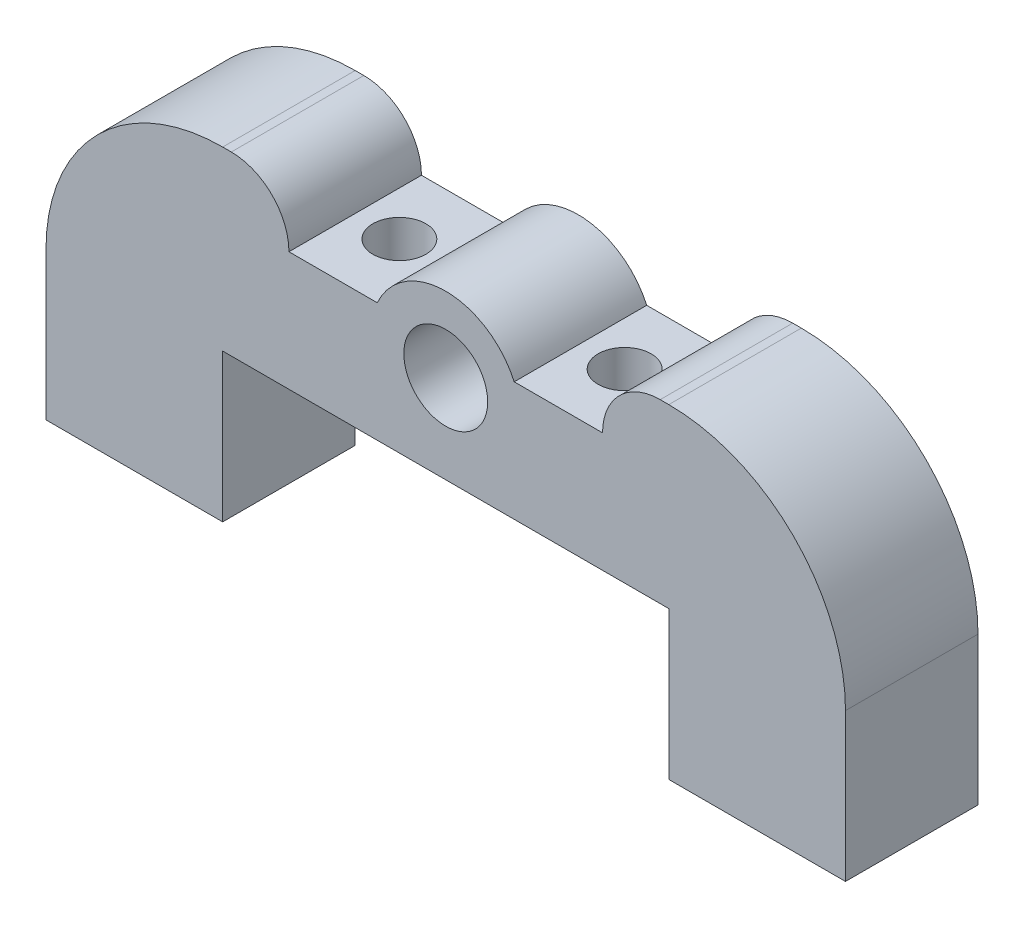
from build123d import *

# Parameters (mm, degrees)
BOSS_EXTRUDE1_DEPTH   = 6
F_6_CLEARANCE_HOLE1_D = 3.7973
CUT_EXTRUDE1_REACH    = 34.362
FILLET1_R             = 2.61
M2_CLEARANCE_HOLE1_D  = 2.4


with BuildPart() as part:
    # Sketch1 → Boss-Extrude1 (new body)
    with BuildSketch(Plane.XY):
        with BuildLine():
            ThreePointArc((-8, 6.7), (-5.656854249, 12.356854249), (0, 14.7))
            Line((0, 14.7), (20.2, 14.7))
            ThreePointArc((20.2, 14.7), (25.856854249, 12.356854249), (28.2, 6.7))
            Line((28.2, 6.7), (28.2, 0))
            Line((28.2, 0), (20.2, 0))
            Line((20.2, 0), (20.2, 6.7))
            Line((20.2, 6.7), (0, 6.7))
            Line((0, 6.7), (0, 0))
            Line((0, 0), (-8, 0))
            Line((-8, 0), (-8, 6.7))
        make_face()
    extrude(amount=BOSS_EXTRUDE1_DEPTH)

    # #6 Clearance Hole1 (through all)
    with Locations(Plane.XY.offset(6)):
        with Locations((10.1, 10.7)):
            Hole(F_6_CLEARANCE_HOLE1_D / 2)

    # Sketch5 → Cut-Extrude1 (cut, up to next)
    with BuildSketch(Plane.XY.offset(6), mode=Mode.PRIVATE) as cut_extrude1_sk1:
        with BuildLine():
            Line((7, 14.7), (3, 14.7))
            Line((3, 14.7), (3, 12.093133814))
            Line((3, 12.093133814), (7, 12.093133814))
            ThreePointArc((7, 12.093133814), (10.1, 14.09865), (13.2, 12.093133814))
            Line((13.2, 12.093133814), (17.2, 12.093133814))
            Line((17.2, 12.093133814), (17.2, 14.7))
            Line((17.2, 14.7), (13.2, 14.7))
            Line((13.2, 14.7), (7, 14.7))
        make_face()
    cut_extrude1_tool1 = extrude(cut_extrude1_sk1.sketch, amount=-CUT_EXTRUDE1_REACH, mode=Mode.PRIVATE) & part.part
    add(cut_extrude1_tool1.solids().sort_by_distance((10.1, 14.243023, 6))[0], mode=Mode.SUBTRACT)

    # Fillet1
    # the kernel refuses this fillet: 2.61 mm, written as the material it takes off along each edge
    with BuildSketch(Plane(origin=(17.2, 14.7, 12.524995297), x_dir=(1, 0, 0), z_dir=(0, 0, -1))) as fillet1_piece_1:
        with BuildLine():
            CenterArc((2.609998119, 2.61), FILLET1_R, 180.068794764, 89.931205236)
            Line((0, 2.606866186), (-0.052199962, 2.60680351))
            Line((-0.052199962, 2.60680351), (-0.0522, 0))
            Line((-0.0522, 0), (0, -0.0522))
            Line((0, -0.0522), (2.609998119, -0.0522))
            Line((2.609998119, -0.0522), (2.609998119, 0))
        make_face()
    extrude(amount=19.049990593, mode=Mode.SUBTRACT)
    with BuildSketch(Plane(origin=(3, 14.7, 12.524995297), x_dir=(-1, 0, 0), z_dir=(0, 0, -1))) as fillet1_piece_2:
        with BuildLine():
            CenterArc((2.609998119, -2.61), FILLET1_R, 90, 89.931205236)
            Line((0, -2.606866186), (-0.052199962, -2.60680351))
            Line((-0.052199962, -2.60680351), (-0.0522, 0))
            Line((-0.0522, 0), (0, 0.0522))
            Line((0, 0.0522), (2.609998119, 0.0522))
            Line((2.609998119, 0.0522), (2.609998119, 0))
        make_face()
    extrude(amount=19.049990593, mode=Mode.SUBTRACT)

    # M2 Clearance Hole1 (through all)
    with Locations(Plane(origin=(0, 12.093133814, 0), x_dir=(1, 0, 0), z_dir=(0, 1, 0))):
        with Locations((5, -3), (15.2, -3)):
            Hole(M2_CLEARANCE_HOLE1_D / 2)


solid = part.part
